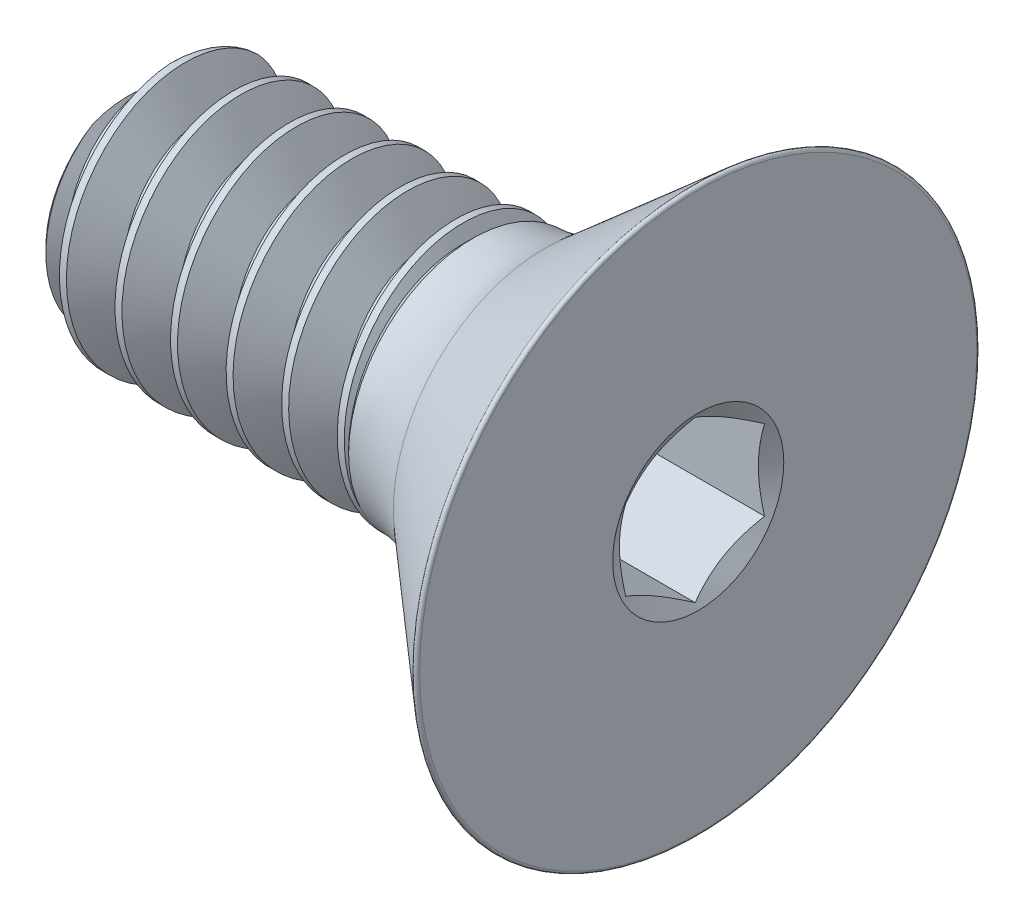
from build123d import *

# Parameters (mm, degrees)
CUT_EXTRUDE1_DEPTH = 1.397
FILLET1_R          = 0.032385
DELETEFACE1_DEPTH  = 1.778
CUT_SWEEP1_PITCH   = 0.635
CUT_SWEEP1_TO      = 3.777208


with BuildPart() as part:
    # Sketch3 → Revolve1 (revolve)
    with BuildSketch(Plane.XY, mode=Mode.PRIVATE) as revolve1_sk:
        with BuildLine():
            Line((-2.8575, 1.4224), (-3.175, 1.1049))
            Line((-3.175, 1.1049), (-3.175, 0))
            Line((-3.175, 0), (3.175, 0))
            Line((3.175, 0), (3.175, 3.255030301))
            Line((3.175, 3.255030301), (1.417432291, 1.7272))
            ThreePointArc((1.417432291, 1.7272), (1.037378384, 1.501091686), (0.602207659, 1.4224))
            Line((0.602207659, 1.4224), (-2.8575, 1.4224))
        make_face()
    revolve(revolve1_sk.sketch.rotate(Axis((3.175, 0, 0), (-1, 0, 0)), 90), axis=Axis((3.175, 0, 0), (-1, 0, 0)))

    # Sketch4 → Cut-Extrude1 (cut)
    with BuildSketch(Plane(origin=(3.175, 0, 0), x_dir=(0, 0, -1), z_dir=(1, 0, 0))):
        Polygon((0, 0.916543552), (-0.79375, 0.458271776), (-0.79375, -0.458271776), (0, -0.916543552), (0.79375, -0.458271776), (0.79375, 0.458271776), align=None)
    extrude(amount=-CUT_EXTRUDE1_DEPTH, mode=Mode.SUBTRACT)

    # Cut-Extrude2 cone 1 section (through the dimple's axis) → Cut-Extrude2 (revolve, cut)
    with BuildSketch(Plane(origin=(3.175, 0, 0), x_dir=(0, 0, -1), z_dir=(0, 1, 0))):
        Polygon((0, 0), (0.977940329, 0), (0, 0.564614112), align=None)
    revolve(axis=Axis((3.175, 0, 0), (-1, 0, 0)), mode=Mode.SUBTRACT)

    # Cut-Extrude3 cone 1 section (through the dimple's axis) → Cut-Extrude3 (revolve, cut)
    with BuildSketch(Plane(origin=(1.778, 0, 0), x_dir=(0, 0, -1), z_dir=(0, 1, 0))):
        Polygon((0, 0), (0.79375, 0), (0, 0.458271776), align=None)
    revolve(axis=Axis((1.778, 0, 0), (-1, 0, 0)), mode=Mode.SUBTRACT)

    # Fillet1
    fillet1_edges = [part.edges().sort_by_distance(p)[0] for p in [
        (3.175, 0, 3.255030301),
    ]]
    fillet(fillet1_edges, radius=FILLET1_R)

    # DeleteFace1: read off the stored shape, not the designer's step
    # DeleteFace1 outline → DeleteFace1 (add)
    with BuildSketch(Plane.YZ):
        Polygon((-0.458271776, -0.79375), (0.458271776, -0.79375), (0.916543552, 0), (0.458271776, 0.79375), (-0.458271776, 0.79375), (-0.916543552, 0), align=None)
    extrude(amount=DELETEFACE1_DEPTH)


with BuildPart() as body_2:
    # Split1: the piece on the far side of the plane
    add(part.part)
    split(bisect_by=Plane(origin=(0.602207659, 0, 0), x_dir=(0, 0, 1), z_dir=(1, 0, 0)), keep=Keep.BOTTOM)

    # Cut-Sweep1: arcs per turn and ends read off the stored shape
    # Cut-Sweep1: the profile of Sketch7 screwed along a right-hand helix through 10 turns, 6 arcs to a turn; built about Z, then put on its axis
    cut_sweep1_z = Axis((0, 0, 0), (0, 0, 1))
    cut_sweep1_corners = [(1.009955401, 0, -0.3175), (1.456770383, 0, -0.57546875), (1.456770383, 0, 0.01984375), (1.009955401, 0, -0.238125)]
    with BuildLine(mode=Mode.PRIVATE) as cut_sweep1_profile:
        Line(cut_sweep1_corners[0], cut_sweep1_corners[1])
        Line(cut_sweep1_corners[1], cut_sweep1_corners[2])
        Line(cut_sweep1_corners[2], cut_sweep1_corners[3])
        Line(cut_sweep1_corners[3], cut_sweep1_corners[0])
    cut_sweep1_cap = Face(cut_sweep1_profile.wire())
    cut_sweep1_turn_angles = [0, 30, 60, 90, 120, 150, 180, 210, 240, 270, 300, 330, 360]
    cut_sweep1_turn_weights = [1, 0.8660254037844387, 1, 0.8660254037844387, 1, 0.8660254037844387, 1, 0.8660254037844387, 1, 0.8660254037844387, 1, 0.8660254037844387, 1]
    cut_sweep1_turn_rails = [Edge.make_bspline([Vector(p[0], p[1], 0).rotate(cut_sweep1_z, cut_sweep1_turn_angles[k]) / cut_sweep1_turn_weights[k] + Vector(0, 0, p[2] + CUT_SWEEP1_PITCH * cut_sweep1_turn_angles[k] / 360) for k in range(13)], [0, 0, 0, 1, 1, 2, 2, 3, 3, 4, 4, 5, 5, 6, 6, 6], 2, cut_sweep1_turn_weights) for p in cut_sweep1_corners]
    cut_sweep1_turn_sides = [Face.make_surface_from_curves(cut_sweep1_turn_rails[p[0]], cut_sweep1_turn_rails[p[1]]) for p in [(0, 1), (1, 2), (2, 3), (3, 0)]]
    cut_sweep1 = Plane(origin=(-3.175, 0, 0), x_dir=(0, -1, 0), z_dir=(1, 0, 0)) * split(Solid(Shell([*[p.moved(Location((0, 0, CUT_SWEEP1_PITCH * i))) for i in range(10) for p in cut_sweep1_turn_sides], cut_sweep1_cap, cut_sweep1_cap.rotate(cut_sweep1_z, 3600).moved(Location((0, 0, CUT_SWEEP1_PITCH * 3600 / 360)))])), bisect_by=Plane.XY.offset(CUT_SWEEP1_TO), keep=Keep.BOTTOM, mode=Mode.PRIVATE)
    add(cut_sweep1, mode=Mode.SUBTRACT)


with BuildPart() as part_1:
    add(part.part)

    # Split1
    split(bisect_by=Plane(origin=(0.602207659, 0, 0), x_dir=(0, 0, 1), z_dir=(1, 0, 0)), keep=Keep.TOP)

    add(body_2.part)  # Revolve2 merges body 2
    # Sketch9 → Revolve2 (revolve)
    with BuildSketch(Plane.XY, mode=Mode.PRIVATE) as revolve2_sk:
        with BuildLine():
            Line((0.602207659, 1.4224), (0.602207659, 0))
            Line((0.602207659, 0), (1.417432291, 0))
            Line((1.417432291, 0), (1.417432291, 1.7272))
            ThreePointArc((1.417432291, 1.7272), (1.037378384, 1.501091686), (0.602207659, 1.4224))
        make_face()
    revolve(revolve2_sk.sketch.rotate(Axis((0.602207659, 0, 0), (1, 0, 0)), 116.113522964), axis=Axis((0.602207659, 0, 0), (1, 0, 0)))

    # Cut-Extrude4 cone 1 section (through the dimple's axis) → Cut-Extrude4 (revolve, cut)
    with BuildSketch(Plane(origin=(1.778, 0, 0), x_dir=(0, 0, -1), z_dir=(0, 1, 0))):
        Polygon((0, 0), (0.79375, 0), (0, 0.458271776), align=None)
    revolve(axis=Axis((1.778, 0, 0), (-1, 0, 0)), mode=Mode.SUBTRACT)

    # Boss-Extrude1 cone 1 section (through the dimple's axis) → Boss-Extrude1 (revolve)
    with BuildSketch(Plane(origin=(0.602207659, 0, 0), x_dir=(0, 0, -1), z_dir=(0, 1, 0))):
        Polygon((0, 0), (1.4224, 0), (0, 1.4224), align=None)
    revolve(axis=Axis((0.602207659, 0, 0), (-1, 0, 0)))


solid = part_1.part
